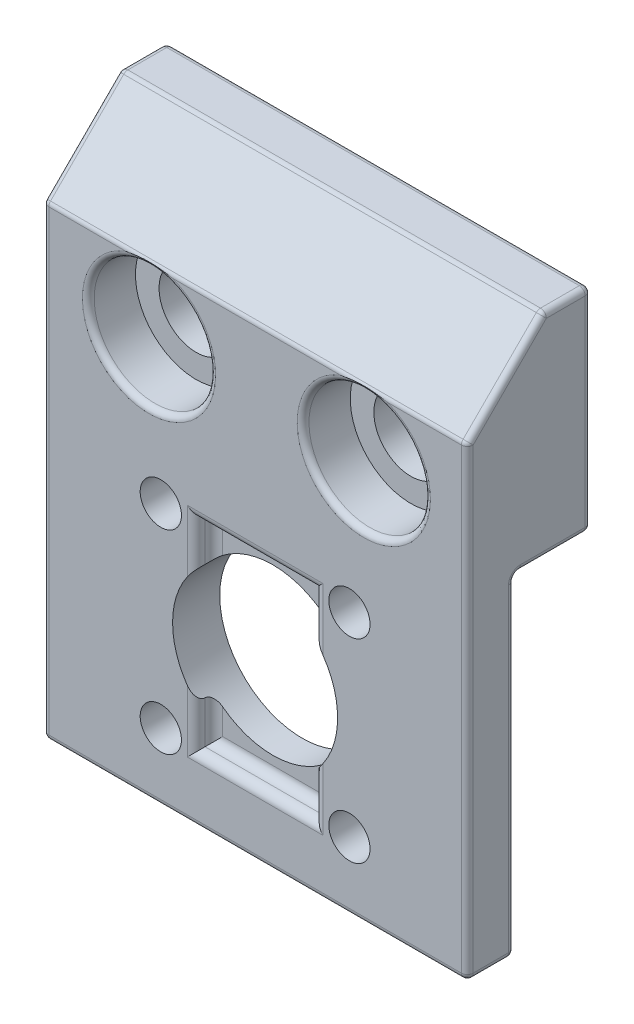
from build123d import *

# Parameters (mm, degrees)
BOSS_EXTRUDE1_DEPTH                     = 18
SKETCH6_R                               = 7
CUT_EXTRUDE1_DEPTH                      = 10
CUT_EXTRUDE2_START                      = -2.5
CUT_EXTRUDE2_DEPTH                      = 1.5
F_4_0MM_DOWEL_HOLE1_D                   = 3.5
CBORE_FOR_M5_HEX_HEAD_BOLT1_D           = 6.3
CBORE_FOR_M5_HEX_HEAD_BOLT1_CBORE_D     = 10.3
CBORE_FOR_M5_HEX_HEAD_BOLT1_CBORE_DEPTH = 4
FILLET1_R                               = 0.5
FILLET3_R                               = 0.75


# Some blends are built 0.0001 mm under size
with BuildPart() as part:
    # Sketch5 → Boss-Extrude1 (new, symmetric)
    with BuildSketch(Plane(origin=(0, 0, 0), x_dir=(0, 0, -1), z_dir=(1, 0, 0))):
        Polygon((0, 14), (0, -14), (-4, -14), (-4, 25.5), (2.5, 32), (6.5, 32), (6.5, 14), align=None)
    extrude(amount=BOSS_EXTRUDE1_DEPTH, both=True)

    # Sketch6 → Cut-Extrude1 (cut)
    with BuildSketch(Plane(origin=(0, 0, 0), x_dir=(-1, 0, 0), z_dir=(0, 0, -1))):
        Circle(SKETCH6_R)
    extrude(amount=-CUT_EXTRUDE1_DEPTH, mode=Mode.SUBTRACT)

    # Sketch6<4> → Cut-Extrude2 (cut)
    with BuildSketch(Plane(origin=(0, 0, 0), x_dir=(-1, 0, 0), z_dir=(0, 0, -1)).offset(CUT_EXTRUDE2_START)):
        with BuildLine():
            Line((-5, 8.5), (-5, 4.898979486))
            ThreePointArc((-5, 4.898979486), (0, 7), (5, 4.898979486))
            Line((5, 4.898979486), (5, 8.5))
            Line((5, 8.5), (-5, 8.5))
        make_face()
        with BuildLine():
            Line((-5, -4.898979486), (-5, -8.5))
            Line((-5, -8.5), (5, -8.5))
            Line((5, -8.5), (5, -4.898979486))
            ThreePointArc((5, -4.898979486), (0, -7), (-5, -4.898979486))
        make_face()
    extrude(amount=-CUT_EXTRUDE2_DEPTH, mode=Mode.SUBTRACT)

    # Ø4.0mm Dowel Hole1 (through all)
    with Locations(Plane.XY.offset(4)):
        with Locations((8, 8.25), (8, -8.25), (-8, -8.25), (-8, 8.25)):
            Hole(F_4_0MM_DOWEL_HOLE1_D / 2)

    # CBORE for M5 Hex Head Bolt1 (through all)
    with Locations(Plane.XY.offset(4)):
        with Locations((9.221124847, 20), (-9, 20)):
            CounterBoreHole(CBORE_FOR_M5_HEX_HEAD_BOLT1_D / 2, CBORE_FOR_M5_HEX_HEAD_BOLT1_CBORE_D / 2, CBORE_FOR_M5_HEX_HEAD_BOLT1_CBORE_DEPTH)

    # Fillet1
    # the kernel refuses this fillet: 0.5 mm, written as the material it adds along each edge
    with BuildSketch(Plane(origin=(-18, 14, 0), x_dir=(0, -1, 0), z_dir=(1, 0, 0))) as fillet1_piece_1:
        with BuildLine():
            CenterArc((FILLET1_R, FILLET1_R), FILLET1_R, 180, 90)
            Line((0, FILLET1_R), (0, 0))
            Line((0, 0), (FILLET1_R, 0))
        make_face()
    extrude(amount=36)
    # the kernel refuses this fillet: 0.5 mm, written as the material it takes off along each edge
    with BuildSketch(Plane(origin=(-17.5, -13.5, 3.5), x_dir=(0, -1, 0), z_dir=(0, 0, 1))) as fillet1_2_piece_1_section:
        Polygon((0, 0), (FILLET1_R, 0), (FILLET1_R, -FILLET1_R), (0, -FILLET1_R), align=None)
    fillet1_2_piece_1 = extrude(amount=FILLET1_R, mode=Mode.PRIVATE)
    fillet1_2_piece_1 = fillet1_2_piece_1 - Plane(origin=(-17.5, -13.5, 3.5), x_dir=(0.7071067811865475, 0.7071067811865475, 0), z_dir=(0, 0, 1)) * Sphere(FILLET1_R, mode=Mode.PRIVATE)
    add(fillet1_2_piece_1, mode=Mode.SUBTRACT)
    with BuildSketch(Plane(origin=(17.5, -13.5, 3.5), x_dir=(1, 0, 0), z_dir=(0, -1, 0))) as fillet1_2_piece_2_section:
        Polygon((0, 0), (FILLET1_R, 0), (FILLET1_R, FILLET1_R), (0, FILLET1_R), align=None)
    fillet1_2_piece_2 = extrude(amount=FILLET1_R, mode=Mode.PRIVATE)
    fillet1_2_piece_2 = fillet1_2_piece_2 - Plane(origin=(17.5, -13.5, 3.5), x_dir=(-0.7071067811865475, 0, -0.7071067811865475), z_dir=(0, -1, 0)) * Sphere(FILLET1_R, mode=Mode.PRIVATE)
    add(fillet1_2_piece_2, mode=Mode.SUBTRACT)
    with BuildSketch(Plane(origin=(17.5, 25.292893219, 3.5), x_dir=(0, 0, 1), z_dir=(1, 0, 0))) as fillet1_2_piece_3_section:
        Polygon((0, 0), (FILLET1_R, 0), (FILLET1_R, -FILLET1_R * 0.414213562373), (FILLET1_R * 0.707106781187, -FILLET1_R * 0.707106781187), align=None)
    fillet1_2_piece_3 = extrude(amount=FILLET1_R, mode=Mode.PRIVATE)
    fillet1_2_piece_3 = fillet1_2_piece_3 - Plane(origin=(17.5, 25.292893219, 3.5), x_dir=(0, -0.38268343236509034, -0.9238795325112865), z_dir=(1, 0, 0)) * Sphere(FILLET1_R, mode=Mode.PRIVATE)
    add(fillet1_2_piece_3, mode=Mode.SUBTRACT)
    with BuildSketch(Plane(origin=(-17.5, 25.292893219, 3.5), x_dir=(0, 0.7071067811865485, 0.7071067811865466), z_dir=(-1, 0, 0))) as fillet1_2_piece_4_section:
        Polygon((0, 0), (FILLET1_R, 0), (FILLET1_R, -FILLET1_R * 0.414213562373), (FILLET1_R * 0.707106781187, -FILLET1_R * 0.707106781187), align=None)
    fillet1_2_piece_4 = extrude(amount=FILLET1_R, mode=Mode.PRIVATE)
    fillet1_2_piece_4 = fillet1_2_piece_4 - Plane(origin=(-17.5, 25.292893219, 3.5), x_dir=(0, -0.38268343236509034, -0.9238795325112865), z_dir=(-1, 0, 0)) * Sphere(FILLET1_R, mode=Mode.PRIVATE)
    add(fillet1_2_piece_4, mode=Mode.SUBTRACT)
    with BuildSketch(Plane(origin=(-17.5, 31.5, -2.707106781), x_dir=(0, 0.7071067811865485, 0.7071067811865466), z_dir=(-1, 0, 0))) as fillet1_2_piece_5_section:
        Polygon((0, 0), (FILLET1_R, 0), (FILLET1_R, FILLET1_R * 0.414213562373), (FILLET1_R * 0.707106781187, FILLET1_R * 0.707106781187), align=None)
    fillet1_2_piece_5 = extrude(amount=FILLET1_R, mode=Mode.PRIVATE)
    fillet1_2_piece_5 = fillet1_2_piece_5 - Plane(origin=(-17.5, 31.5, -2.707106781), x_dir=(0, -0.9238795325112866, -0.38268343236509), z_dir=(-1, 0, 0)) * Sphere(FILLET1_R, mode=Mode.PRIVATE)
    add(fillet1_2_piece_5, mode=Mode.SUBTRACT)
    with BuildSketch(Plane(origin=(17.5, 31.5, -2.707106781), x_dir=(0, 0.7071067811865485, 0.7071067811865466), z_dir=(1, 0, 0))) as fillet1_2_piece_6_section:
        Polygon((0, 0), (FILLET1_R, 0), (FILLET1_R, -FILLET1_R * 0.414213562373), (FILLET1_R * 0.707106781187, -FILLET1_R * 0.707106781187), align=None)
    fillet1_2_piece_6 = extrude(amount=FILLET1_R, mode=Mode.PRIVATE)
    fillet1_2_piece_6 = fillet1_2_piece_6 - Plane(origin=(17.5, 31.5, -2.707106781), x_dir=(0, -0.9238795325112866, -0.38268343236509), z_dir=(1, 0, 0)) * Sphere(FILLET1_R, mode=Mode.PRIVATE)
    add(fillet1_2_piece_6, mode=Mode.SUBTRACT)
    with BuildSketch(Plane(origin=(-17.5, 31.5, -6), x_dir=(0, 1, 0), z_dir=(-1, 0, 0))) as fillet1_2_piece_7_section:
        Polygon((0, 0), (FILLET1_R, 0), (FILLET1_R, FILLET1_R), (0, FILLET1_R), align=None)
    fillet1_2_piece_7 = extrude(amount=FILLET1_R, mode=Mode.PRIVATE)
    fillet1_2_piece_7 = fillet1_2_piece_7 - Plane(origin=(-17.5, 31.5, -6), x_dir=(0, -0.707106781186548, 0.7071067811865471), z_dir=(-1, 0, 0)) * Sphere(FILLET1_R, mode=Mode.PRIVATE)
    add(fillet1_2_piece_7, mode=Mode.SUBTRACT)
    with BuildSketch(Plane(origin=(17.5, 31.5, -6), x_dir=(0, 1, 0), z_dir=(1, 0, 0))) as fillet1_2_piece_8_section:
        Polygon((0, 0), (FILLET1_R, 0), (FILLET1_R, -FILLET1_R), (0, -FILLET1_R), align=None)
    fillet1_2_piece_8 = extrude(amount=FILLET1_R, mode=Mode.PRIVATE)
    fillet1_2_piece_8 = fillet1_2_piece_8 - Plane(origin=(17.5, 31.5, -6), x_dir=(0, -0.707106781186548, 0.7071067811865471), z_dir=(1, 0, 0)) * Sphere(FILLET1_R, mode=Mode.PRIVATE)
    add(fillet1_2_piece_8, mode=Mode.SUBTRACT)
    with BuildSketch(Plane(origin=(-18, -14, -1.25), x_dir=(1, 0, 0), z_dir=(0, 0, 1)), Plane(origin=(18, -14, -1.25), x_dir=(0, 1, 0), z_dir=(0, 0, 1))) as fillet1_2_piece_9:
        with BuildLine():
            CenterArc((FILLET1_R, FILLET1_R), FILLET1_R, 180, 90)
            Line((0, FILLET1_R), (0, 0))
            Line((0, 0), (FILLET1_R, 0))
        make_face()
    extrude(amount=4.75, mode=Mode.SUBTRACT)
    with BuildSketch(Plane(origin=(18, -13.5, 4), x_dir=(0, 0, -1), z_dir=(0, 1, 0))) as fillet1_2_piece_10:
        with BuildLine():
            CenterArc((FILLET1_R, FILLET1_R), FILLET1_R, 180, 90)
            Line((0, FILLET1_R), (0, 0))
            Line((0, 0), (FILLET1_R, 0))
        make_face()
    extrude(amount=38.792893219, mode=Mode.SUBTRACT)
    with BuildSketch(Plane(origin=(-18, -13.5, 4), x_dir=(0, 0, -1), z_dir=(0, 1, 0))) as fillet1_2_piece_11:
        with BuildLine():
            CenterArc((FILLET1_R, -FILLET1_R), FILLET1_R, 90, 90)
            Line((0, -FILLET1_R), (0, 0))
            Line((0, 0), (FILLET1_R, 0))
        make_face()
    extrude(amount=38.792893219, mode=Mode.SUBTRACT)
    with BuildSketch(Plane(origin=(-18, 25.646446609, 3.853553391), x_dir=(0, -0.7071067811865486, -0.7071067811865466), z_dir=(0, 0.7071067811865466, -0.7071067811865485))) as fillet1_2_piece_12:
        with BuildLine():
            CenterArc((FILLET1_R, -FILLET1_R), FILLET1_R, 90, 90)
            Line((0, -FILLET1_R), (0, 0))
            Line((0, 0), (FILLET1_R, 0))
        make_face()
    extrude(amount=8.778174593, mode=Mode.SUBTRACT)
    with BuildSketch(Plane(origin=(17.5, 32, -2.5), x_dir=(0, -0.7071067811865421, 0.7071067811865528), z_dir=(-1, 0, 0)), Plane(origin=(17.5, 25.5, 4), x_dir=(0, -1, 0), z_dir=(-1, 0, 0))) as fillet1_2_piece_13:
        with BuildLine():
            CenterArc((FILLET1_R * 0.414213562373, -FILLET1_R), FILLET1_R, 90, 45)
            Line((-FILLET1_R * 0.292893218813, -FILLET1_R * 0.292893218813), (0, 0))
            Line((0, 0), (FILLET1_R * 0.414213562373, 0))
        make_face()
    extrude(amount=35, mode=Mode.SUBTRACT)
    with BuildSketch(Plane(origin=(-17.5, 32, -6.5), x_dir=(0, 0, 1), z_dir=(1, 0, 0))) as fillet1_2_piece_14:
        with BuildLine():
            CenterArc((FILLET1_R, FILLET1_R), FILLET1_R, 180, 90)
            Line((0, FILLET1_R), (0, 0))
            Line((0, 0), (FILLET1_R, 0))
        make_face()
    extrude(amount=35, mode=Mode.SUBTRACT)
    with BuildSketch(Plane(origin=(-19.25, 14, -6.5), x_dir=(0, 0, 1), z_dir=(1, 0, 0)), Plane(origin=(19.25, -14, 0), x_dir=(0, 1, 0), z_dir=(-1, 0, 0))) as fillet1_2_piece_15:
        with BuildLine():
            CenterArc((FILLET1_R, -FILLET1_R), FILLET1_R, 90, 90)
            Line((0, -FILLET1_R), (0, 0))
            Line((0, 0), (FILLET1_R, 0))
        make_face()
    extrude(amount=38.5, mode=Mode.SUBTRACT)
    with BuildSketch(Plane(origin=(17.5, -14, 4), x_dir=(0, 0, -1), z_dir=(-1, 0, 0))) as fillet1_2_piece_16:
        with BuildLine():
            CenterArc((FILLET1_R, -FILLET1_R), FILLET1_R, 90, 90)
            Line((0, -FILLET1_R), (0, 0))
            Line((0, 0), (FILLET1_R, 0))
        make_face()
    extrude(amount=35, mode=Mode.SUBTRACT)
    with BuildSketch(Plane(origin=(18, 31.5, -6.5), x_dir=(0, 0, 1), z_dir=(0, -1, 0))) as fillet1_2_piece_17:
        with BuildLine():
            CenterArc((FILLET1_R, FILLET1_R), FILLET1_R, 180, 90)
            Line((0, FILLET1_R), (0, 0))
            Line((0, 0), (FILLET1_R, 0))
        make_face()
    extrude(amount=18.75, mode=Mode.SUBTRACT)
    with BuildSketch(Plane(origin=(18, 32, -2.707106781), x_dir=(0, -1, 0), z_dir=(0, 0, -1))) as fillet1_2_piece_18:
        with BuildLine():
            CenterArc((FILLET1_R, FILLET1_R), FILLET1_R, 180, 90)
            Line((0, FILLET1_R), (0, 0))
            Line((0, 0), (FILLET1_R, 0))
        make_face()
    extrude(amount=3.292893219, mode=Mode.SUBTRACT)
    with BuildSketch(Plane(origin=(18, 25.646446609, 3.853553391), x_dir=(0, -0.7071067811865486, -0.7071067811865466), z_dir=(0, 0.7071067811865466, -0.7071067811865485))) as fillet1_2_piece_19:
        with BuildLine():
            CenterArc((FILLET1_R, FILLET1_R), FILLET1_R, 180, 90)
            Line((0, FILLET1_R), (0, 0))
            Line((0, 0), (FILLET1_R, 0))
        make_face()
    extrude(amount=8.778174593, mode=Mode.SUBTRACT)
    with BuildSketch(Plane(origin=(-18, 32, -2.707106781), x_dir=(0, -1, 0), z_dir=(0, 0, -1))) as fillet1_2_piece_20:
        with BuildLine():
            CenterArc((FILLET1_R, -FILLET1_R), FILLET1_R, 90, 90)
            Line((0, -FILLET1_R), (0, 0))
            Line((0, 0), (FILLET1_R, 0))
        make_face()
    extrude(amount=3.292893219, mode=Mode.SUBTRACT)
    with BuildSketch(Plane(origin=(9.221124847, 20, 4), x_dir=(1, 0, 0), z_dir=(0, -1, 0))) as fillet1_2_piece_21:
        with BuildLine():
            CenterArc((5.15 + FILLET1_R, -FILLET1_R), FILLET1_R, 90, 90)
            Line((5.15, -FILLET1_R), (5.15, 0))
            Line((5.15, 0), (5.15 + FILLET1_R, 0))
        make_face()
    revolve(axis=Axis((9.221124847, 20, 4), (0, 0, 1)), mode=Mode.SUBTRACT)
    with BuildSketch(Plane(origin=(-18, 31.5, -6.5), x_dir=(0, 0, 1), z_dir=(0, -1, 0))) as fillet1_2_piece_22:
        with BuildLine():
            CenterArc((FILLET1_R, -FILLET1_R), FILLET1_R, 90, 90)
            Line((0, -FILLET1_R), (0, 0))
            Line((0, 0), (FILLET1_R, 0))
        make_face()
    extrude(amount=18.75, mode=Mode.SUBTRACT)
    with BuildSketch(Plane(origin=(-9, 20, 4), x_dir=(1, 0, 0), z_dir=(0, -1, 0))) as fillet1_2_piece_23:
        with BuildLine():
            CenterArc((5.15 + FILLET1_R, -FILLET1_R), FILLET1_R, 90, 90)
            Line((5.15, -FILLET1_R), (5.15, 0))
            Line((5.15, 0), (5.15 + FILLET1_R, 0))
        make_face()
    revolve(axis=Axis((-9, 20, 4), (0, 0, 1)), mode=Mode.SUBTRACT)
    # the kernel refuses this fillet: 0.5 mm, written as the material it takes off along each edge
    with BuildSketch(Plane(origin=(-17.5, 14.5, -6), x_dir=(0, -1, 0), z_dir=(-1, 0, 0))) as fillet1_3_piece_1_section:
        Polygon((0, 0), (FILLET1_R, 0), (FILLET1_R, -FILLET1_R), (0, -FILLET1_R), align=None)
    fillet1_3_piece_1 = extrude(amount=FILLET1_R, mode=Mode.PRIVATE)
    fillet1_3_piece_1 = fillet1_3_piece_1 - Plane(origin=(-17.5, 14.5, -6), x_dir=(0, 0.7071067811865476, 0.7071067811865476), z_dir=(-1, 0, 0)) * Sphere(FILLET1_R, mode=Mode.PRIVATE)
    add(fillet1_3_piece_1, mode=Mode.SUBTRACT)
    with BuildSketch(Plane(origin=(17.5, 14.5, -6), x_dir=(0, -1, 0), z_dir=(1, 0, 0))) as fillet1_3_piece_2_section:
        Polygon((0, 0), (FILLET1_R, 0), (FILLET1_R, FILLET1_R), (0, FILLET1_R), align=None)
    fillet1_3_piece_2 = extrude(amount=FILLET1_R, mode=Mode.PRIVATE)
    fillet1_3_piece_2 = fillet1_3_piece_2 - Plane(origin=(17.5, 14.5, -6), x_dir=(0, 0.7071067811865476, 0.7071067811865476), z_dir=(1, 0, 0)) * Sphere(FILLET1_R, mode=Mode.PRIVATE)
    add(fillet1_3_piece_2, mode=Mode.SUBTRACT)
    with BuildSketch(Plane(origin=(17.5, -13.5, 0.5), x_dir=(1, 0, 0), z_dir=(0, 0, -1))) as fillet1_3_piece_3_section:
        Polygon((0, 0), (FILLET1_R, 0), (FILLET1_R, FILLET1_R), (0, FILLET1_R), align=None)
    fillet1_3_piece_3 = extrude(amount=FILLET1_R, mode=Mode.PRIVATE)
    fillet1_3_piece_3 = fillet1_3_piece_3 - Plane(origin=(17.5, -13.5, 0.5), x_dir=(-0.7071067811865475, 0.7071067811865475, 0), z_dir=(0, 0, -1)) * Sphere(FILLET1_R, mode=Mode.PRIVATE)
    add(fillet1_3_piece_3, mode=Mode.SUBTRACT)
    with BuildSketch(Plane(origin=(-17.5, -13.5, 0.5), x_dir=(-1, 0, 0), z_dir=(0, 0, -1))) as fillet1_3_piece_4_section:
        Polygon((0, 0), (FILLET1_R, 0), (FILLET1_R, -FILLET1_R), (0, -FILLET1_R), align=None)
    fillet1_3_piece_4 = extrude(amount=FILLET1_R, mode=Mode.PRIVATE)
    fillet1_3_piece_4 = fillet1_3_piece_4 - Plane(origin=(-17.5, -13.5, 0.5), x_dir=(0.7071067811865475, 0.7071067811865475, 0), z_dir=(0, 0, -1)) * Sphere(FILLET1_R, mode=Mode.PRIVATE)
    add(fillet1_3_piece_4, mode=Mode.SUBTRACT)
    with BuildSketch(Plane(origin=(-18, 13.5, 0), x_dir=(1, 0, 0), z_dir=(0, -1, 0))) as fillet1_3_piece_5:
        with BuildLine():
            CenterArc((FILLET1_R, FILLET1_R), FILLET1_R, 180, 90)
            Line((0, FILLET1_R), (0, 0))
            Line((0, 0), (FILLET1_R, 0))
        make_face()
    extrude(amount=27, mode=Mode.SUBTRACT)
    with BuildSketch(Plane(origin=(18, 13.5, 0), x_dir=(-1, 0, 0), z_dir=(0, -1, 0))) as fillet1_3_piece_6:
        with BuildLine():
            CenterArc((FILLET1_R, -FILLET1_R), FILLET1_R, 90, 90)
            Line((0, -FILLET1_R), (0, 0))
            Line((0, 0), (FILLET1_R, 0))
        make_face()
    extrude(amount=27, mode=Mode.SUBTRACT)
    with BuildSketch(Plane(origin=(18, 14, -6), x_dir=(0, 1, 0), z_dir=(0, 0, 1))) as fillet1_3_piece_7:
        with BuildLine():
            CenterArc((FILLET1_R, FILLET1_R), FILLET1_R, 180, 90)
            Line((0, FILLET1_R), (0, 0))
            Line((0, 0), (FILLET1_R, 0))
        make_face()
    extrude(amount=5.5, mode=Mode.SUBTRACT)
    with BuildSketch(Plane(origin=(-18, 14, -6), x_dir=(0, 1, 0), z_dir=(0, 0, 1))) as fillet1_3_piece_8:
        with BuildLine():
            CenterArc((FILLET1_R, -FILLET1_R), FILLET1_R, 90, 90)
            Line((0, -FILLET1_R), (0, 0))
            Line((0, 0), (FILLET1_R, 0))
        make_face()
    extrude(amount=5.5, mode=Mode.SUBTRACT)
    with BuildSketch(Plane(origin=(-18, 13.5, -0.5), x_dir=(0, 0, 1), z_dir=(0, -1, 0))) as fillet1_3_piece_9:
        with BuildLine():
            CenterArc((0.5 + FILLET1_R, -FILLET1_R), FILLET1_R, 90, 90)
            Line((0.5 + FILLET1_R, 0), (0.5, 0))
            Line((0.5, 0), (0.5, -FILLET1_R))
        make_face()
    revolve(axis=Axis((-18, 13.5, -0.5), (-1, 0, 0)), revolution_arc=90, mode=Mode.SUBTRACT)
    with BuildSketch(Plane(origin=(18, 13.5, -0.5), x_dir=(0, 0, 1), z_dir=(0, -1, 0))) as fillet1_3_piece_10:
        with BuildLine():
            CenterArc((0.5 + FILLET1_R, FILLET1_R), FILLET1_R, 180, 90)
            Line((0.5 + FILLET1_R, 0), (0.5, 0))
            Line((0.5, 0), (0.5, FILLET1_R))
        make_face()
    revolve(axis=Axis((18, 13.5, -0.5), (-1, 0, 0)), revolution_arc=90, mode=Mode.SUBTRACT)

    # Fillet3
    fillet3_edges = [part.edges().sort_by_distance(p)[0] for p in [
        (5, -6.699489743, 4),
        (5, -6.699489743, 2.5),
        (0, -8.5, 2.5),
        (5, 6.699489743, 4),
        (5, 6.699489743, 2.5),
        (-5, 6.699489743, 4),
        (0, 8.5, 4),
        (0, 8.5, 2.5),
        (-5, 6.699489743, 2.5),
        (0, -8.5, 4),
        (-5, -6.699489743, 4),
        (-5, -6.699489743, 2.5),
    ]]
    fillet(fillet3_edges, radius=FILLET3_R - 0.0001)  # a hair under: the kernel refuses the full size


solid = part.part
